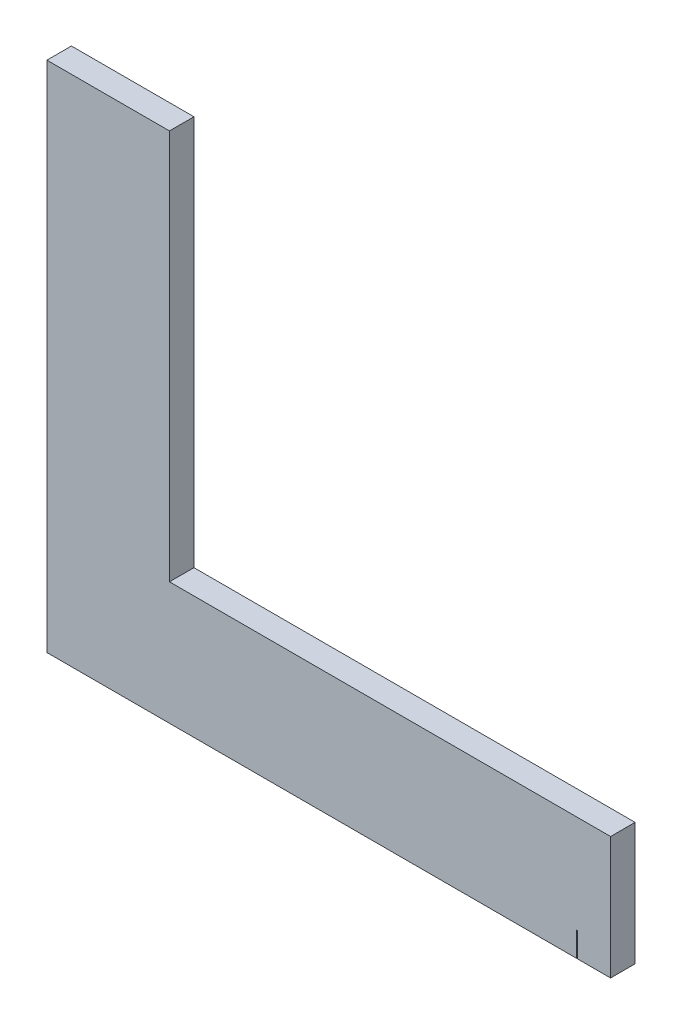
from build123d import *

# Parameters (mm, degrees)
BOSS_EXTRUDE1_DEPTH = 3
SKETCH2_W           = 0.1
SKETCH2_H           = 3
CUT_EXTRUDE2_DEPTH  = 3


with BuildPart() as part:
    # Sketch1 → Boss-Extrude1 (new body)
    with BuildSketch(Plane.XY):
        Polygon((0, 0), (0, -62.8), (69, -62.8), (69, -47.8), (15, -47.8), (15, 0), align=None)
    extrude(amount=BOSS_EXTRUDE1_DEPTH)

    # Sketch2 → Cut-Extrude2 (cut)
    with BuildSketch(Plane.XZ.offset(62.8)):
        with Locations((64.9, 1.5)):
            Rectangle(SKETCH2_W, SKETCH2_H)
    extrude(amount=-CUT_EXTRUDE2_DEPTH, mode=Mode.SUBTRACT)


solid = part.part
